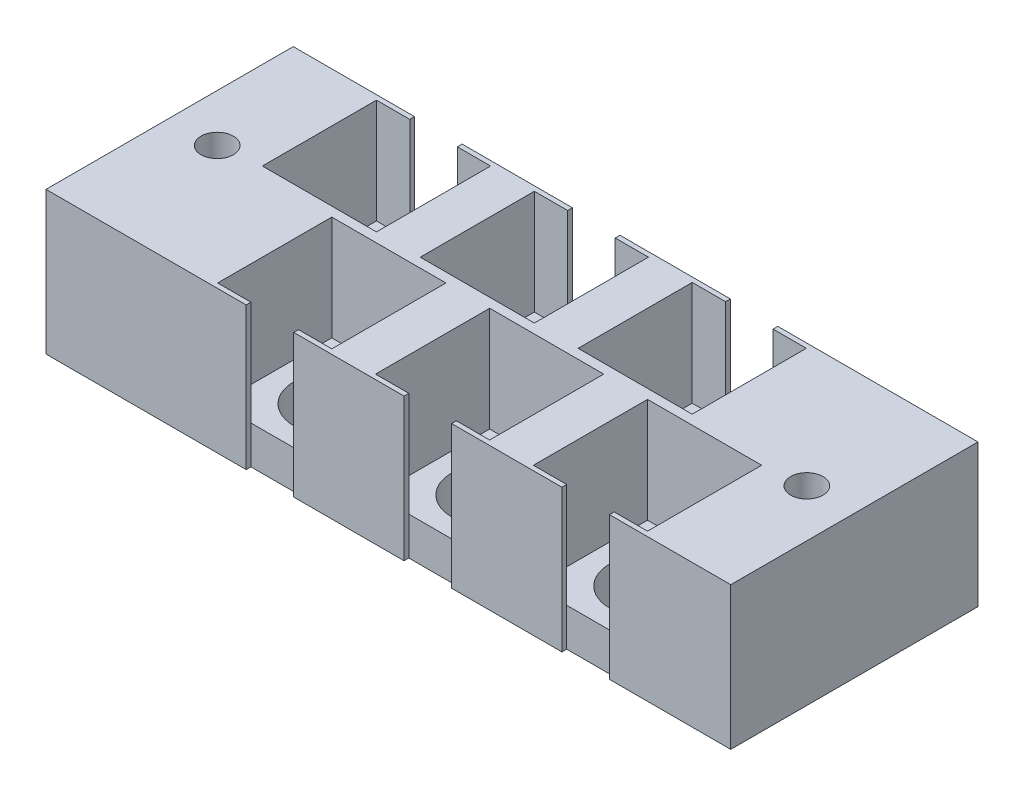
from build123d import *

# Parameters (mm, degrees)
SKETCH1_W             = 12
SKETCH1_H             = 12
SKETCH1_R             = 4
BOSS_EXTRUDE1_DEPTH   = 4
BOSS_EXTRUDE1_2_DEPTH = 4
BOSS_EXTRUDE1_3_DEPTH = 4
BOSS_EXTRUDE1_4_DEPTH = 4
BOSS_EXTRUDE1_5_DEPTH = 4
BOSS_EXTRUDE1_6_DEPTH = 4
SKETCH1_3_R           = 1.7
BOSS_EXTRUDE2_DEPTH   = 15
SKETCH2_W             = 2.2
SKETCH2_H             = 5.00000001
SKETCH2_H_2           = 5.000000011
BOSS_EXTRUDE3_DEPTH   = 9


with BuildPart() as part:
    # Sketch1 → Boss-Extrude1 (new body)
    with BuildSketch(Plane(origin=(0, 0, 0), x_dir=(1, 0, 0), z_dir=(0, 1, 0))):
        with Locations((11.886385948, -10.664884408)):
            Rectangle(SKETCH1_W, SKETCH1_H)
        with Locations((11.886385948, -10.664884408)):
            Circle(SKETCH1_R, mode=Mode.SUBTRACT)
    extrude(amount=BOSS_EXTRUDE1_DEPTH)



with BuildPart() as body_2:
    # Sketch1 → Boss-Extrude1 2 (new body)
    with BuildSketch(Plane(origin=(0, 0, 0), x_dir=(1, 0, 0), z_dir=(0, 1, 0))):
        with Locations((-4.713614052, -10.664885052)):
            Rectangle(SKETCH1_W, SKETCH1_H)
        with Locations((-4.713614052, -10.664885052)):
            Circle(SKETCH1_R, mode=Mode.SUBTRACT)
    extrude(amount=BOSS_EXTRUDE1_2_DEPTH)


with BuildPart() as body_3:
    # Sketch1 → Boss-Extrude1 3 (new body)
    with BuildSketch(Plane(origin=(0, 0, 0), x_dir=(1, 0, 0), z_dir=(0, 1, 0))):
        with Locations((3.586385956, -23.664883973)):
            Rectangle(SKETCH1_W, SKETCH1_H)
        with Locations((3.586385956, -23.664883973)):
            Circle(SKETCH1_R, mode=Mode.SUBTRACT)
    extrude(amount=BOSS_EXTRUDE1_3_DEPTH)


with BuildPart() as body_4:
    # Sketch1 → Boss-Extrude1 4 (new body)
    with BuildSketch(Plane(origin=(0, 0, 0), x_dir=(1, 0, 0), z_dir=(0, 1, 0))):
        with Locations((20.186385956, -23.664884408)):
            Rectangle(SKETCH1_W, SKETCH1_H)
        with Locations((20.186385956, -23.664884408)):
            Circle(SKETCH1_R, mode=Mode.SUBTRACT)
    extrude(amount=BOSS_EXTRUDE1_4_DEPTH)


with BuildPart() as body_5:
    # Sketch1 → Boss-Extrude1 5 (new body)
    with BuildSketch(Plane(origin=(0, 0, 0), x_dir=(1, 0, 0), z_dir=(0, 1, 0))):
        with Locations((28.486385948, -10.664884408)):
            Rectangle(SKETCH1_W, SKETCH1_H)
        with Locations((28.486385948, -10.664884408)):
            Circle(SKETCH1_R, mode=Mode.SUBTRACT)
    extrude(amount=BOSS_EXTRUDE1_5_DEPTH)


with BuildPart() as body_6:
    # Sketch1 → Boss-Extrude1 6 (new body)
    with BuildSketch(Plane(origin=(0, 0, 0), x_dir=(1, 0, 0), z_dir=(0, 1, 0))):
        with Locations((36.786385956, -23.66488461)):
            Rectangle(SKETCH1_W, SKETCH1_H)
        with Locations((36.786385956, -23.66488461)):
            Circle(SKETCH1_R, mode=Mode.SUBTRACT)
    extrude(amount=BOSS_EXTRUDE1_6_DEPTH)


with BuildPart() as part_1:
    add(part.part)

    add(body_2.part)  # Boss-Extrude2 merges body 2

    add(body_3.part)  # Boss-Extrude2 merges body 3

    add(body_4.part)  # Boss-Extrude2 merges body 4

    add(body_5.part)  # Boss-Extrude2 merges body 5

    add(body_6.part)  # Boss-Extrude2 merges body 6
    # Sketch1<3> → Boss-Extrude2 (add)
    with BuildSketch(Plane(origin=(0, 0, 0), x_dir=(1, 0, 0), z_dir=(0, 1, 0))):
        Polygon((5.386385948, -4.164884408), (1.786385948, -4.164885052), (-2.213614052, -4.164885052), (-2.213614052, -4.664885052), (1.286385948, -4.664885052), (1.286385948, -16.664885052), (-10.713614052, -16.664885052), (-10.713614052, -4.664885052), (-7.213614052, -4.664885052), (-7.213614052, -4.164885052), (-19.963614052, -4.164885052), (-19.963614052, -30.164883973), (1.086385956, -30.164883973), (1.086385956, -29.664883973), (-2.413614044, -29.664883973), (-2.413614044, -17.664883973), (9.586385956, -17.664883973), (9.586385956, -29.664883973), (6.086385956, -29.664883973), (6.086385956, -30.164883973), (10.086385956, -30.164883973), (13.686385956, -30.164884408), (17.686385956, -30.164884408), (17.686385956, -29.664884408), (14.186385956, -29.664884408), (14.186385956, -17.664884408), (26.186385956, -17.664884408), (26.186385956, -29.664884408), (22.686385956, -29.664884408), (22.686385956, -30.164884408), (26.686385956, -30.164884408), (30.286385956, -30.16488461), (34.286385956, -30.16488461), (34.286385956, -29.66488461), (30.786385956, -29.66488461), (30.786385956, -17.66488461), (42.786385956, -17.66488461), (42.786385956, -29.66488461), (39.286385956, -29.66488461), (39.286385956, -30.16488461), (43.286385956, -30.16488461), (52.036385956, -30.164883973), (52.036385956, -4.164885052), (34.986385948, -4.164884408), (30.986385948, -4.164884408), (30.986385948, -4.664884408), (34.486385948, -4.664884408), (34.486385948, -16.664884408), (22.486385948, -16.664884408), (22.486385948, -4.664884408), (25.986385948, -4.664884408), (25.986385948, -4.164884408), (14.386385948, -4.164884408), (14.386385948, -4.664884408), (17.886385948, -4.664884408), (17.886385948, -16.664884408), (5.886385948, -16.664884408), (5.886385948, -4.664884408), (9.386385948, -4.664884408), (9.386385948, -4.164884408), align=None)
        with Locations((-14.963614052, -17.164884513)):
            Circle(SKETCH1_3_R, mode=Mode.SUBTRACT)
        with Locations((47.036385956, -17.164884513)):
            Circle(SKETCH1_3_R, mode=Mode.SUBTRACT)
    extrude(amount=BOSS_EXTRUDE2_DEPTH)

    # Sketch2 → Boss-Extrude3 (add)
    with BuildSketch(Plane.XZ):
        with Locations((-0.413614044, 17.164884518)):
            Rectangle(SKETCH2_W, SKETCH2_H)
        with Locations((7.586385956, 17.164884518)):
            Rectangle(SKETCH2_W, SKETCH2_H)
        with Locations((16.186385956, 17.164884518)):
            Rectangle(SKETCH2_W, SKETCH2_H)
        with Locations((24.186385956, 17.164884518)):
            Rectangle(SKETCH2_W, SKETCH2_H)
        with Locations((32.786385956, 17.164884508)):
            Rectangle(SKETCH2_W, SKETCH2_H_2)
    extrude(amount=BOSS_EXTRUDE3_DEPTH)


solid = part_1.part
